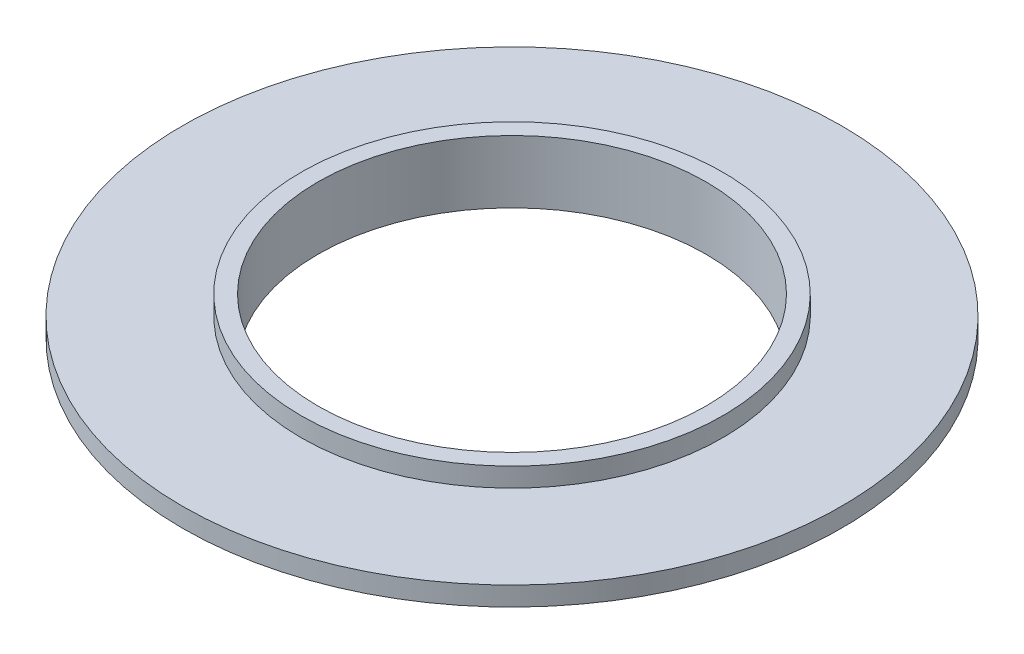
from build123d import *
from build123d.topology import SkipClean

# Parameters (mm, degrees)
CROQUIS1_R              = 35.597110005
CROQUIS1_R_2            = 26.191176114
SALIENTE_EXTRUIR1_DEPTH = 1.5
CROQUIS2_R              = 60.448384053
SALIENTE_EXTRUIR2_DEPTH = 3.5
CROQUIS3_R              = 38.685318644
CROQUIS3_R_2            = 35.604684405
SALIENTE_EXTRUIR3_DEPTH = 3.5
CROQUIS4_R              = 35.604684405
CORTAR_EXTRUIR1_DEPTH   = 86.558542935
CROQUIS5_R              = 39.680725698
CROQUIS5_R_2            = 35.604684405
SALIENTE_EXTRUIR4_DEPTH = 4.5


with BuildPart() as part:
    # Croquis1 → Saliente-Extruir1 (new body)
    with BuildSketch(Plane(origin=(0, 0, 0), x_dir=(1, 0, 0), z_dir=(0, 1, 0))):
        Circle(CROQUIS1_R)
        Circle(CROQUIS1_R_2, mode=Mode.SUBTRACT)
    extrude(amount=SALIENTE_EXTRUIR1_DEPTH)

    # Croquis2 → Saliente-Extruir2 (add)
    with BuildSketch(Plane(origin=(0, 1.5, 0), x_dir=(1, 0, 0), z_dir=(0, 1, 0))):
        Circle(CROQUIS2_R)
    extrude(amount=-SALIENTE_EXTRUIR2_DEPTH)

    # Croquis3 → Saliente-Extruir3 (add)
    with BuildSketch(Plane(origin=(0, 1.5, 0), x_dir=(1, 0, 0), z_dir=(0, 1, 0))):
        Circle(CROQUIS3_R)
        Circle(CROQUIS3_R_2, mode=Mode.SUBTRACT)
    extrude(amount=SALIENTE_EXTRUIR3_DEPTH)

    # Croquis4 → Cortar-Extruir1 (cut, through all)
    with BuildSketch(Plane(origin=(0, 1.5, 0), x_dir=(1, 0, 0), z_dir=(0, 1, 0))):
        Circle(CROQUIS4_R)
    extrude(amount=-CORTAR_EXTRUIR1_DEPTH, mode=Mode.SUBTRACT)

    # Croquis5 → Saliente-Extruir4 (add)
    with SkipClean():  # the faces are left unmerged after this step: merging them gives an invalid solid
        with BuildSketch(Plane(origin=(0, -2, 0), x_dir=(-1, 0, 0), z_dir=(0, -1, 0))):
            Circle(CROQUIS5_R)
            Circle(CROQUIS5_R_2, mode=Mode.SUBTRACT)
        extrude(amount=SALIENTE_EXTRUIR4_DEPTH)
    add(part.part.scale(1), mode=Mode.REPLACE)  # the faces are merged on a copy


solid = part.part
